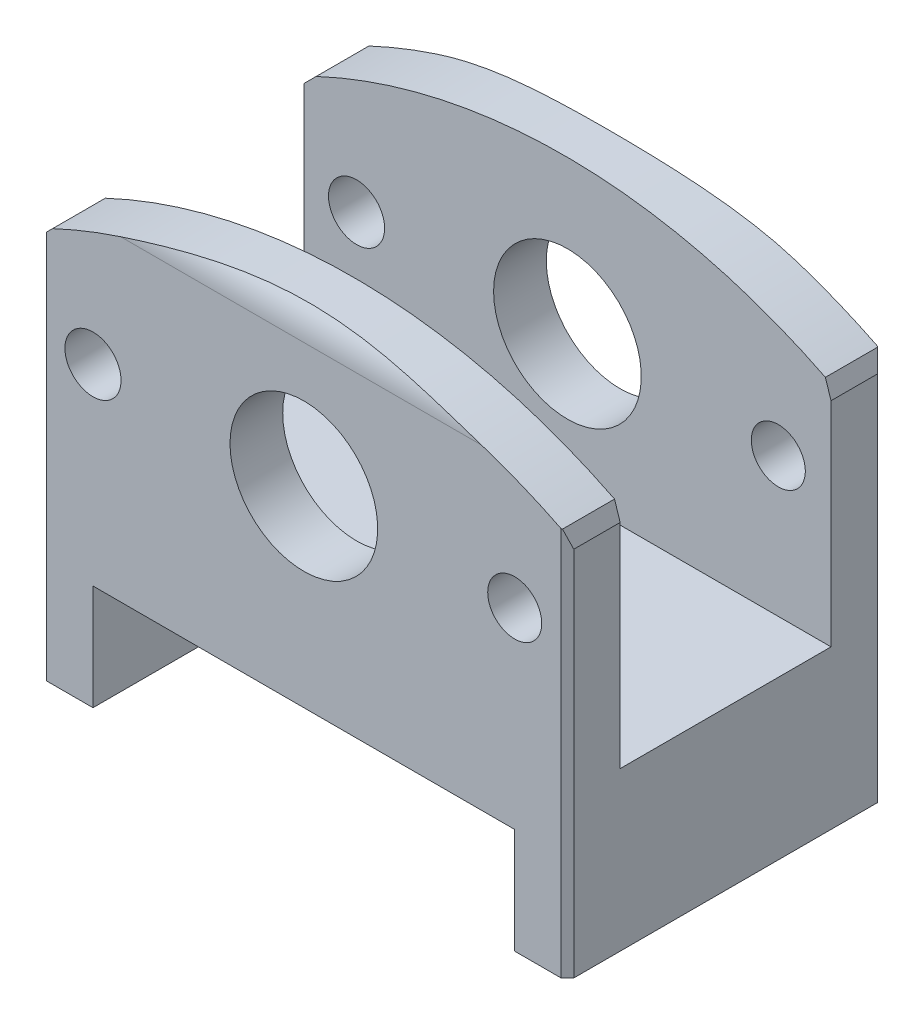
from build123d import *

# Parameters (mm, degrees)
SKETCH1_W               = 63.5
SKETCH1_H               = 57.15
BOSS_EXTRUDE1_DEPTH     = 38.1
SKETCH2_W               = 50.8
SKETCH2_H               = 12.7
CUT_EXTRUDE1_DEPTH      = 94.541341128
SKETCH3_W               = 63.5
SKETCH3_H               = 25.4
CUT_EXTRUDE2_DEPTH      = 38.1
FILLET3_R               = 6.35
FILLET4_R               = 6.35
SKETCH4_R               = 3.252730628
SKETCH4_R_2             = 3.379495502
SKETCH4_R_3             = 8.895504244
CUT_EXTRUDE3_DEPTH      = 94.541341128
CHAMFER1_SIZE           = 0.762
CHAMFER2_SIZE           = 0.762
CUT_EXTRUDE5_DEPTH      = 92.139645599
CUT_EXTRUDE5_DEPTH_BACK = 92.139645599
CHAMFER3_SIZE           = 0.762
CHAMFER3_SIZE_2         = 1.762810924


# Some blends are built 0.0001 mm under size
with BuildPart() as part:
    # Sketch1 → Boss-Extrude1 (new body)
    with BuildSketch(Plane.XY):
        with Locations((31.75, 28.575)):
            Rectangle(SKETCH1_W, SKETCH1_H)
    extrude(amount=BOSS_EXTRUDE1_DEPTH)

    # Sketch2 → Cut-Extrude1 (cut, through all)
    with BuildSketch(Plane(origin=(0, 0, 0), x_dir=(-1, 0, 0), z_dir=(0, 0, -1))):
        with Locations((-31.75, 6.35)):
            Rectangle(SKETCH2_W, SKETCH2_H)
    extrude(amount=-CUT_EXTRUDE1_DEPTH, mode=Mode.SUBTRACT)

    # Sketch3 → Cut-Extrude2 (cut)
    with BuildSketch(Plane(origin=(0, 57.15, 0), x_dir=(1, 0, 0), z_dir=(0, 1, 0))):
        with Locations((31.75, -19.05)):
            Rectangle(SKETCH3_W, SKETCH3_H)
    extrude(amount=-CUT_EXTRUDE2_DEPTH, mode=Mode.SUBTRACT)

    # Fillet3
    fillet3_edges = [part.edges().sort_by_distance(p)[0] for p in [
        (31.75, 57.15, 38.1),
    ]]
    fillet(fillet3_edges, radius=FILLET3_R - 0.0001)  # a hair under: the kernel refuses the full size

    # Fillet4
    fillet4_edges = [part.edges().sort_by_distance(p)[0] for p in [
        (31.75, 57.15, 0),
    ]]
    fillet(fillet4_edges, radius=FILLET4_R - 0.0001)  # a hair under: the kernel refuses the full size

    # Sketch4 → Cut-Extrude3 (cut, through all)
    with BuildSketch(Plane(origin=(0, 0, 0), x_dir=(-1, 0, 0), z_dir=(0, 0, -1))):
        with Locations((-57.15, 35.819311932)):
            Circle(SKETCH4_R)
        with Locations((-6.35, 35.819311932)):
            Circle(SKETCH4_R_2)
        with Locations((-31.75, 35.819311932)):
            Circle(SKETCH4_R_3)
    extrude(amount=-CUT_EXTRUDE3_DEPTH, mode=Mode.SUBTRACT)

    # Chamfer1
    chamfer1_edges = [part.edges().sort_by_distance(p)[0] for p in [
        (63.5, 55.29015735, 1.85984265),
        (63.5, 25.40005, 0),
    ]]
    chamfer(chamfer1_edges, length=CHAMFER1_SIZE)

    # Chamfer2
    chamfer2_edges = [part.edges().sort_by_distance(p)[0] for p in [
        (0, 25.40005, 38.1),
        (63.5, 55.29015735, 36.24015735),
        (0, 55.29015735, 36.24015735),
        (0, 25.40005, 0),
        (0, 55.29015735, 1.85984265),
        (63.5, 25.40005, 38.1),
    ]]
    chamfer(chamfer2_edges, length=CHAMFER2_SIZE)

    # Sketch5 → Cut-Extrude5 (cut, two sides: drawn at the far end of the back side and taken through both)
    with BuildSketch(Plane(origin=(0, 0, 31.75), x_dir=(-1, 0, 0), z_dir=(0, 0, -1)).offset(-CUT_EXTRUDE5_DEPTH_BACK)):
        with BuildLine():
            Line((152.450199575, -35.171760157), (1.839159199, 45.87092885))
            ThreePointArc((1.839159199, 45.87092885), (-32.809317684, 54.236506182), (-67.098653648, 44.502993274))
            Line((-67.098653648, 44.502993274), (-214.376135409, -42.450708722))
            Line((-214.376135409, -42.450708722), (-221.162348462, 299.543968154))
            Line((-221.162348462, 299.543968154), (145.663986523, 306.822916719))
            Line((145.663986523, 306.822916719), (152.450199575, -35.171760157))
        make_face()
    extrude(amount=CUT_EXTRUDE5_DEPTH + CUT_EXTRUDE5_DEPTH_BACK, mode=Mode.SUBTRACT)

    # Chamfer3
    # the kernel refuses this chamfer: 1.762810924, 1.706340641, 0.762 mm, written as the material it takes off along each edge
    with BuildSketch(Plane(origin=(0, 46.825825111, -3.52035895), x_dir=(0.8994074011398961, 0.43711134368119303, 0), z_dir=(0, 0, 1))) as chamfer3_piece_1:
        with BuildLine():
            Line((1.648294394, 0), (-CHAMFER3_SIZE * 0.437111343681, -CHAMFER3_SIZE * 0.89940740114))
            Line((-CHAMFER3_SIZE * 0.437111343681, -CHAMFER3_SIZE * 0.89940740114), (0, 0))
            ThreePointArc((0, 0), (0.856396227, 0.004831664), (1.648294394, 0))
        make_face()
    extrude(amount=14.152717899, mode=Mode.SUBTRACT)
    with BuildSketch(Plane(origin=(0, 46.825825111, 27.46764105), x_dir=(0, -1, 0), z_dir=(0, 0, 1))) as chamfer3_piece_2:
        with BuildLine():
            Line((CHAMFER3_SIZE, 0), (-0.720488177, 1.482488177))
            ThreePointArc((-0.720488177, 1.482488177), (-0.37868614, 0.76813713), (0, 0))
            Line((0, 0), (CHAMFER3_SIZE, 0))
        make_face()
    extrude(amount=14.152717899, mode=Mode.SUBTRACT)
    with BuildSketch(Plane(origin=(63.5, 46.487927277, -3.813189181), x_dir=(-0.8918533135709217, 0.4523247363040928, 0), z_dir=(0, 0, 1))) as chamfer3_piece_3:
        with BuildLine():
            Line((0.757918605, 0), (-CHAMFER3_SIZE_2 * 0.452324736297, CHAMFER3_SIZE_2 * 0.891853313556))
            Line((-CHAMFER3_SIZE_2 * 0.452324736297, CHAMFER3_SIZE_2 * 0.891853313556), (0, 0))
            ThreePointArc((0, 0), (0.403745747, -0.001018742), (0.757918605, 0))
        make_face()
    extrude(amount=14.738378362, mode=Mode.SUBTRACT)
    with BuildSketch(Plane(origin=(63.5, 46.487927277, 27.174810819), x_dir=(0, -1, 0), z_dir=(0, 0, 1))) as chamfer3_piece_4:
        with BuildLine():
            Line((CHAMFER3_SIZE_2, 0), (-0.342825333, -0.675952219))
            ThreePointArc((-0.342825333, -0.675952219), (-0.183532757, -0.35962118), (0, 0))
            Line((0, 0), (CHAMFER3_SIZE_2, 0))
        make_face()
    extrude(amount=14.738378362, mode=Mode.SUBTRACT)


solid = part.part
